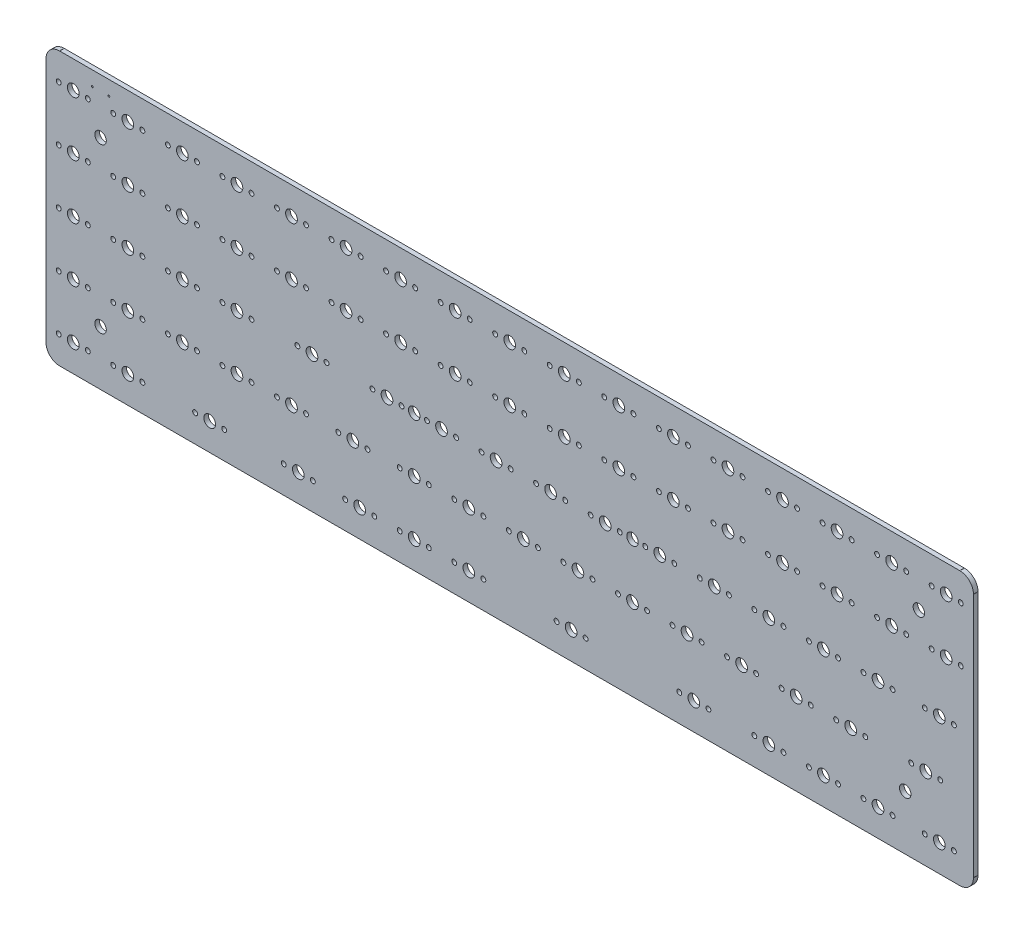
from build123d import *

# Parameters (mm, degrees)
SKETCH2_R           = 0.8534
SKETCH2_R_2         = 2.0447
SKETCH2_R_3         = 2
SKETCH2_R_4         = 0.325
BOSS_EXTRUDE3_DEPTH = 0.79375


with BuildPart() as part:
    # Sketch2 → Boss-Extrude3 (new, symmetric)
    with BuildSketch(Plane.XY):
        with BuildLine():
            ThreePointArc((314.2869, -4.7625), (314.298059232, -4.735559232), (314.325, -4.7244))
            Line((314.325, -4.7244), (314.325, 80.9244))
            ThreePointArc((314.325, 80.9244), (314.298059232, 80.935559232), (314.2869, 80.9625))
            ThreePointArc((314.2869, 80.9625), (314.298005094, 80.989386522), (314.324846721, 81.000599692))
            ThreePointArc((314.324846721, 81.000599692), (312.93006375, 84.33006375), (309.600599692, 85.724846721))
            ThreePointArc((309.600599692, 85.724846721), (309.589386522, 85.698005094), (309.5625, 85.6869))
            ThreePointArc((309.5625, 85.6869), (309.535559232, 85.698059232), (309.5244, 85.725))
            Line((309.5244, 85.725), (-4.7244, 85.725))
            ThreePointArc((-4.7244, 85.725), (-4.735559232, 85.698059232), (-4.7625, 85.6869))
            ThreePointArc((-4.7625, 85.6869), (-4.789386522, 85.698005094), (-4.800599692, 85.724846721))
            ThreePointArc((-4.800599692, 85.724846721), (-8.13006375, 84.33006375), (-9.524846721, 81.000599692))
            ThreePointArc((-9.524846721, 81.000599692), (-9.498005094, 80.989386522), (-9.4869, 80.9625))
            ThreePointArc((-9.4869, 80.9625), (-9.498059232, 80.935559232), (-9.525, 80.9244))
            Line((-9.525, 80.9244), (-9.525, -4.7244))
            ThreePointArc((-9.525, -4.7244), (-9.498059232, -4.735559232), (-9.4869, -4.7625))
            ThreePointArc((-9.4869, -4.7625), (-9.498005094, -4.789386522), (-9.524846721, -4.800599692))
            ThreePointArc((-9.524846721, -4.800599692), (-8.13006375, -8.13006375), (-4.800599692, -9.524846721))
            ThreePointArc((-4.800599692, -9.524846721), (-4.789386522, -9.498005094), (-4.7625, -9.4869))
            ThreePointArc((-4.7625, -9.4869), (-4.735559232, -9.498059232), (-4.7244, -9.525))
            Line((-4.7244, -9.525), (309.5244, -9.525))
            ThreePointArc((309.5244, -9.525), (309.535559232, -9.498059232), (309.5625, -9.4869))
            ThreePointArc((309.5625, -9.4869), (309.589386522, -9.498005094), (309.600599692, -9.524846721))
            ThreePointArc((309.600599692, -9.524846721), (312.93006375, -8.13006375), (314.324846721, -4.800599692))
            ThreePointArc((314.324846721, -4.800599692), (314.298005094, -4.789386522), (314.2869, -4.7625))
        make_face()
        with Locations((-5.08, 0)):
            Circle(SKETCH2_R, mode=Mode.SUBTRACT)
        Circle(SKETCH2_R_2, mode=Mode.SUBTRACT)
        with Locations((5.08, 0)):
            Circle(SKETCH2_R, mode=Mode.SUBTRACT)
        with Locations((13.97, 0)):
            Circle(SKETCH2_R, mode=Mode.SUBTRACT)
        with Locations((19.05, 0)):
            Circle(SKETCH2_R_2, mode=Mode.SUBTRACT)
        with Locations((24.13, 0)):
            Circle(SKETCH2_R, mode=Mode.SUBTRACT)
        with Locations((42.545, 0)):
            Circle(SKETCH2_R, mode=Mode.SUBTRACT)
        with Locations((47.625, 0)):
            Circle(SKETCH2_R_2, mode=Mode.SUBTRACT)
        with Locations((52.705, 0)):
            Circle(SKETCH2_R, mode=Mode.SUBTRACT)
        with Locations((9.525, 9.525)):
            Circle(SKETCH2_R_3, mode=Mode.SUBTRACT)
        with Locations((73.5012, 0)):
            Circle(SKETCH2_R, mode=Mode.SUBTRACT)
        with Locations((78.5812, 0)):
            Circle(SKETCH2_R_2, mode=Mode.SUBTRACT)
        with Locations((83.6613, 0)):
            Circle(SKETCH2_R, mode=Mode.SUBTRACT)
        with Locations((94.9325, 0)):
            Circle(SKETCH2_R, mode=Mode.SUBTRACT)
        with Locations((100.0125, 0)):
            Circle(SKETCH2_R_2, mode=Mode.SUBTRACT)
        with Locations((105.0925, 0)):
            Circle(SKETCH2_R, mode=Mode.SUBTRACT)
        with Locations((113.9825, 0)):
            Circle(SKETCH2_R, mode=Mode.SUBTRACT)
        with Locations((119.0625, 0)):
            Circle(SKETCH2_R_2, mode=Mode.SUBTRACT)
        with Locations((124.1425, 0)):
            Circle(SKETCH2_R, mode=Mode.SUBTRACT)
        with Locations((133.0325, 0)):
            Circle(SKETCH2_R, mode=Mode.SUBTRACT)
        with Locations((138.1125, 0)):
            Circle(SKETCH2_R_2, mode=Mode.SUBTRACT)
        with Locations((143.1925, 0)):
            Circle(SKETCH2_R, mode=Mode.SUBTRACT)
        with Locations((-5.08, 19.05)):
            Circle(SKETCH2_R, mode=Mode.SUBTRACT)
        with Locations((0, 19.05)):
            Circle(SKETCH2_R_2, mode=Mode.SUBTRACT)
        with Locations((5.08, 19.05)):
            Circle(SKETCH2_R, mode=Mode.SUBTRACT)
        with Locations((13.97, 19.05)):
            Circle(SKETCH2_R, mode=Mode.SUBTRACT)
        with Locations((19.05, 19.05)):
            Circle(SKETCH2_R_2, mode=Mode.SUBTRACT)
        with Locations((24.13, 19.05)):
            Circle(SKETCH2_R, mode=Mode.SUBTRACT)
        with Locations((33.02, 19.05)):
            Circle(SKETCH2_R, mode=Mode.SUBTRACT)
        with Locations((38.1, 19.05)):
            Circle(SKETCH2_R_2, mode=Mode.SUBTRACT)
        with Locations((43.18, 19.05)):
            Circle(SKETCH2_R, mode=Mode.SUBTRACT)
        with Locations((52.07, 19.05)):
            Circle(SKETCH2_R, mode=Mode.SUBTRACT)
        with Locations((57.15, 19.05)):
            Circle(SKETCH2_R_2, mode=Mode.SUBTRACT)
        with Locations((62.23, 19.05)):
            Circle(SKETCH2_R, mode=Mode.SUBTRACT)
        with Locations((71.12, 19.05)):
            Circle(SKETCH2_R, mode=Mode.SUBTRACT)
        with Locations((76.2, 19.05)):
            Circle(SKETCH2_R_2, mode=Mode.SUBTRACT)
        with Locations((81.28, 19.05)):
            Circle(SKETCH2_R, mode=Mode.SUBTRACT)
        with Locations((92.5513, 19.05)):
            Circle(SKETCH2_R, mode=Mode.SUBTRACT)
        with Locations((97.6313, 19.05)):
            Circle(SKETCH2_R_2, mode=Mode.SUBTRACT)
        with Locations((102.7113, 19.05)):
            Circle(SKETCH2_R, mode=Mode.SUBTRACT)
        with Locations((113.9825, 19.05)):
            Circle(SKETCH2_R, mode=Mode.SUBTRACT)
        with Locations((119.0625, 19.05)):
            Circle(SKETCH2_R_2, mode=Mode.SUBTRACT)
        with Locations((124.1425, 19.05)):
            Circle(SKETCH2_R, mode=Mode.SUBTRACT)
        with Locations((133.0325, 19.05)):
            Circle(SKETCH2_R, mode=Mode.SUBTRACT)
        with Locations((138.1125, 19.05)):
            Circle(SKETCH2_R_2, mode=Mode.SUBTRACT)
        with Locations((143.1925, 19.05)):
            Circle(SKETCH2_R, mode=Mode.SUBTRACT)
        with Locations((152.0825, 19.05)):
            Circle(SKETCH2_R, mode=Mode.SUBTRACT)
        with Locations((168.7512, 0)):
            Circle(SKETCH2_R, mode=Mode.SUBTRACT)
        with Locations((173.8313, 0)):
            Circle(SKETCH2_R_2, mode=Mode.SUBTRACT)
        with Locations((178.9112, 0)):
            Circle(SKETCH2_R, mode=Mode.SUBTRACT)
        with Locations((211.6138, 0)):
            Circle(SKETCH2_R, mode=Mode.SUBTRACT)
        with Locations((216.6938, 0)):
            Circle(SKETCH2_R_2, mode=Mode.SUBTRACT)
        with Locations((221.7738, 0)):
            Circle(SKETCH2_R, mode=Mode.SUBTRACT)
        with Locations((237.8075, 0)):
            Circle(SKETCH2_R, mode=Mode.SUBTRACT)
        with Locations((242.8875, 0)):
            Circle(SKETCH2_R_2, mode=Mode.SUBTRACT)
        with Locations((247.9675, 0)):
            Circle(SKETCH2_R, mode=Mode.SUBTRACT)
        with Locations((256.8575, 0)):
            Circle(SKETCH2_R, mode=Mode.SUBTRACT)
        with Locations((261.9375, 0)):
            Circle(SKETCH2_R_2, mode=Mode.SUBTRACT)
        with Locations((267.0175, 0)):
            Circle(SKETCH2_R, mode=Mode.SUBTRACT)
        with Locations((275.9075, 0)):
            Circle(SKETCH2_R, mode=Mode.SUBTRACT)
        with Locations((280.9875, 0)):
            Circle(SKETCH2_R_2, mode=Mode.SUBTRACT)
        with Locations((286.0675, 0)):
            Circle(SKETCH2_R, mode=Mode.SUBTRACT)
        with Locations((297.3388, 0)):
            Circle(SKETCH2_R, mode=Mode.SUBTRACT)
        with Locations((302.4187, 0)):
            Circle(SKETCH2_R_2, mode=Mode.SUBTRACT)
        with Locations((307.4988, 0)):
            Circle(SKETCH2_R, mode=Mode.SUBTRACT)
        with Locations((290.5125, 9.525)):
            Circle(SKETCH2_R_3, mode=Mode.SUBTRACT)
        with Locations((157.1625, 19.05)):
            Circle(SKETCH2_R_2, mode=Mode.SUBTRACT)
        with Locations((162.2425, 19.05)):
            Circle(SKETCH2_R, mode=Mode.SUBTRACT)
        with Locations((171.1325, 19.05)):
            Circle(SKETCH2_R, mode=Mode.SUBTRACT)
        with Locations((176.2125, 19.05)):
            Circle(SKETCH2_R_2, mode=Mode.SUBTRACT)
        with Locations((181.2925, 19.05)):
            Circle(SKETCH2_R, mode=Mode.SUBTRACT)
        with Locations((190.1825, 19.05)):
            Circle(SKETCH2_R, mode=Mode.SUBTRACT)
        with Locations((195.2625, 19.05)):
            Circle(SKETCH2_R_2, mode=Mode.SUBTRACT)
        with Locations((200.3425, 19.05)):
            Circle(SKETCH2_R, mode=Mode.SUBTRACT)
        with Locations((209.2325, 19.05)):
            Circle(SKETCH2_R, mode=Mode.SUBTRACT)
        with Locations((214.3125, 19.05)):
            Circle(SKETCH2_R_2, mode=Mode.SUBTRACT)
        with Locations((219.3925, 19.05)):
            Circle(SKETCH2_R, mode=Mode.SUBTRACT)
        with Locations((228.2825, 19.05)):
            Circle(SKETCH2_R, mode=Mode.SUBTRACT)
        with Locations((233.3625, 19.05)):
            Circle(SKETCH2_R_2, mode=Mode.SUBTRACT)
        with Locations((238.4425, 19.05)):
            Circle(SKETCH2_R, mode=Mode.SUBTRACT)
        with Locations((247.3325, 19.05)):
            Circle(SKETCH2_R, mode=Mode.SUBTRACT)
        with Locations((252.4125, 19.05)):
            Circle(SKETCH2_R_2, mode=Mode.SUBTRACT)
        with Locations((257.4925, 19.05)):
            Circle(SKETCH2_R, mode=Mode.SUBTRACT)
        with Locations((266.3825, 19.05)):
            Circle(SKETCH2_R, mode=Mode.SUBTRACT)
        with Locations((271.4625, 19.05)):
            Circle(SKETCH2_R_2, mode=Mode.SUBTRACT)
        with Locations((276.5425, 19.05)):
            Circle(SKETCH2_R, mode=Mode.SUBTRACT)
        with Locations((292.5763, 19.05)):
            Circle(SKETCH2_R, mode=Mode.SUBTRACT)
        with Locations((297.6563, 19.05)):
            Circle(SKETCH2_R_2, mode=Mode.SUBTRACT)
        with Locations((302.7363, 19.05)):
            Circle(SKETCH2_R, mode=Mode.SUBTRACT)
        with Locations((-5.08, 38.1)):
            Circle(SKETCH2_R, mode=Mode.SUBTRACT)
        with Locations((0, 38.1)):
            Circle(SKETCH2_R_2, mode=Mode.SUBTRACT)
        with Locations((5.08, 38.1)):
            Circle(SKETCH2_R, mode=Mode.SUBTRACT)
        with Locations((13.97, 38.1)):
            Circle(SKETCH2_R, mode=Mode.SUBTRACT)
        with Locations((19.05, 38.1)):
            Circle(SKETCH2_R_2, mode=Mode.SUBTRACT)
        with Locations((24.13, 38.1)):
            Circle(SKETCH2_R, mode=Mode.SUBTRACT)
        with Locations((33.02, 38.1)):
            Circle(SKETCH2_R, mode=Mode.SUBTRACT)
        with Locations((38.1, 38.1)):
            Circle(SKETCH2_R_2, mode=Mode.SUBTRACT)
        with Locations((43.18, 38.1)):
            Circle(SKETCH2_R, mode=Mode.SUBTRACT)
        with Locations((52.07, 38.1)):
            Circle(SKETCH2_R, mode=Mode.SUBTRACT)
        with Locations((57.15, 38.1)):
            Circle(SKETCH2_R_2, mode=Mode.SUBTRACT)
        with Locations((62.23, 38.1)):
            Circle(SKETCH2_R, mode=Mode.SUBTRACT)
        with Locations((-5.08, 57.15)):
            Circle(SKETCH2_R, mode=Mode.SUBTRACT)
        with Locations((0, 57.15)):
            Circle(SKETCH2_R_2, mode=Mode.SUBTRACT)
        with Locations((5.08, 57.15)):
            Circle(SKETCH2_R, mode=Mode.SUBTRACT)
        with Locations((13.97, 57.15)):
            Circle(SKETCH2_R, mode=Mode.SUBTRACT)
        with Locations((19.05, 57.15)):
            Circle(SKETCH2_R_2, mode=Mode.SUBTRACT)
        with Locations((24.13, 57.15)):
            Circle(SKETCH2_R, mode=Mode.SUBTRACT)
        with Locations((33.02, 57.15)):
            Circle(SKETCH2_R, mode=Mode.SUBTRACT)
        with Locations((38.1, 57.15)):
            Circle(SKETCH2_R_2, mode=Mode.SUBTRACT)
        with Locations((43.18, 57.15)):
            Circle(SKETCH2_R, mode=Mode.SUBTRACT)
        with Locations((52.07, 57.15)):
            Circle(SKETCH2_R, mode=Mode.SUBTRACT)
        with Locations((57.15, 57.15)):
            Circle(SKETCH2_R_2, mode=Mode.SUBTRACT)
        with Locations((62.23, 57.15)):
            Circle(SKETCH2_R, mode=Mode.SUBTRACT)
        with Locations((71.12, 57.15)):
            Circle(SKETCH2_R, mode=Mode.SUBTRACT)
        with Locations((78.2638, 38.1)):
            Circle(SKETCH2_R, mode=Mode.SUBTRACT)
        with Locations((83.3438, 38.1)):
            Circle(SKETCH2_R_2, mode=Mode.SUBTRACT)
        with Locations((88.4237, 38.1)):
            Circle(SKETCH2_R, mode=Mode.SUBTRACT)
        with Locations((104.4575, 38.1)):
            Circle(SKETCH2_R, mode=Mode.SUBTRACT)
        with Locations((109.5375, 38.1)):
            Circle(SKETCH2_R_2, mode=Mode.SUBTRACT)
        with Locations((114.6175, 38.1)):
            Circle(SKETCH2_R, mode=Mode.SUBTRACT)
        with Locations((119.0625, 38.1)):
            Circle(SKETCH2_R_3, mode=Mode.SUBTRACT)
        with Locations((123.5075, 38.1)):
            Circle(SKETCH2_R, mode=Mode.SUBTRACT)
        with Locations((128.5875, 38.1)):
            Circle(SKETCH2_R_2, mode=Mode.SUBTRACT)
        with Locations((133.6675, 38.1)):
            Circle(SKETCH2_R, mode=Mode.SUBTRACT)
        with Locations((142.5575, 38.1)):
            Circle(SKETCH2_R, mode=Mode.SUBTRACT)
        with Locations((147.6375, 38.1)):
            Circle(SKETCH2_R_2, mode=Mode.SUBTRACT)
        with Locations((76.2, 57.15)):
            Circle(SKETCH2_R_2, mode=Mode.SUBTRACT)
        with Locations((81.28, 57.15)):
            Circle(SKETCH2_R, mode=Mode.SUBTRACT)
        with Locations((90.17, 57.15)):
            Circle(SKETCH2_R, mode=Mode.SUBTRACT)
        with Locations((95.25, 57.15)):
            Circle(SKETCH2_R_2, mode=Mode.SUBTRACT)
        with Locations((100.33, 57.15)):
            Circle(SKETCH2_R, mode=Mode.SUBTRACT)
        with Locations((109.22, 57.15)):
            Circle(SKETCH2_R, mode=Mode.SUBTRACT)
        with Locations((114.3, 57.15)):
            Circle(SKETCH2_R_2, mode=Mode.SUBTRACT)
        with Locations((119.38, 57.15)):
            Circle(SKETCH2_R, mode=Mode.SUBTRACT)
        with Locations((128.27, 57.15)):
            Circle(SKETCH2_R, mode=Mode.SUBTRACT)
        with Locations((133.35, 57.15)):
            Circle(SKETCH2_R_2, mode=Mode.SUBTRACT)
        with Locations((138.43, 57.15)):
            Circle(SKETCH2_R, mode=Mode.SUBTRACT)
        with Locations((147.32, 57.15)):
            Circle(SKETCH2_R, mode=Mode.SUBTRACT)
        with Locations((9.525, 66.675)):
            Circle(SKETCH2_R_3, mode=Mode.SUBTRACT)
        with Locations((-5.08, 76.2)):
            Circle(SKETCH2_R, mode=Mode.SUBTRACT)
        with Locations((0, 76.2)):
            Circle(SKETCH2_R_2, mode=Mode.SUBTRACT)
        with Locations((5.08, 76.2)):
            Circle(SKETCH2_R, mode=Mode.SUBTRACT)
        with Locations((13.97, 76.2)):
            Circle(SKETCH2_R, mode=Mode.SUBTRACT)
        with Locations((19.05, 76.2)):
            Circle(SKETCH2_R_2, mode=Mode.SUBTRACT)
        with Locations((24.13, 76.2)):
            Circle(SKETCH2_R, mode=Mode.SUBTRACT)
        with Locations((6.635, 80.6463)):
            Circle(SKETCH2_R_4, mode=Mode.SUBTRACT)
        with Locations((12.415, 80.6463)):
            Circle(SKETCH2_R_4, mode=Mode.SUBTRACT)
        with Locations((33.02, 76.2)):
            Circle(SKETCH2_R, mode=Mode.SUBTRACT)
        with Locations((38.1, 76.2)):
            Circle(SKETCH2_R_2, mode=Mode.SUBTRACT)
        with Locations((43.18, 76.2)):
            Circle(SKETCH2_R, mode=Mode.SUBTRACT)
        with Locations((52.07, 76.2)):
            Circle(SKETCH2_R, mode=Mode.SUBTRACT)
        with Locations((57.15, 76.2)):
            Circle(SKETCH2_R_2, mode=Mode.SUBTRACT)
        with Locations((62.23, 76.2)):
            Circle(SKETCH2_R, mode=Mode.SUBTRACT)
        with Locations((71.12, 76.2)):
            Circle(SKETCH2_R, mode=Mode.SUBTRACT)
        with Locations((76.2, 76.2)):
            Circle(SKETCH2_R_2, mode=Mode.SUBTRACT)
        with Locations((81.28, 76.2)):
            Circle(SKETCH2_R, mode=Mode.SUBTRACT)
        with Locations((90.17, 76.2)):
            Circle(SKETCH2_R, mode=Mode.SUBTRACT)
        with Locations((95.25, 76.2)):
            Circle(SKETCH2_R_2, mode=Mode.SUBTRACT)
        with Locations((100.33, 76.2)):
            Circle(SKETCH2_R, mode=Mode.SUBTRACT)
        with Locations((109.22, 76.2)):
            Circle(SKETCH2_R, mode=Mode.SUBTRACT)
        with Locations((114.3, 76.2)):
            Circle(SKETCH2_R_2, mode=Mode.SUBTRACT)
        with Locations((119.38, 76.2)):
            Circle(SKETCH2_R, mode=Mode.SUBTRACT)
        with Locations((128.27, 76.2)):
            Circle(SKETCH2_R, mode=Mode.SUBTRACT)
        with Locations((133.35, 76.2)):
            Circle(SKETCH2_R_2, mode=Mode.SUBTRACT)
        with Locations((138.43, 76.2)):
            Circle(SKETCH2_R, mode=Mode.SUBTRACT)
        with Locations((147.32, 76.2)):
            Circle(SKETCH2_R, mode=Mode.SUBTRACT)
        with Locations((152.7175, 38.1)):
            Circle(SKETCH2_R, mode=Mode.SUBTRACT)
        with Locations((161.6075, 38.1)):
            Circle(SKETCH2_R, mode=Mode.SUBTRACT)
        with Locations((166.6875, 38.1)):
            Circle(SKETCH2_R_2, mode=Mode.SUBTRACT)
        with Locations((171.7675, 38.1)):
            Circle(SKETCH2_R, mode=Mode.SUBTRACT)
        with Locations((180.6575, 38.1)):
            Circle(SKETCH2_R, mode=Mode.SUBTRACT)
        with Locations((185.7375, 38.1)):
            Circle(SKETCH2_R_2, mode=Mode.SUBTRACT)
        with Locations((190.8175, 38.1)):
            Circle(SKETCH2_R, mode=Mode.SUBTRACT)
        with Locations((195.2625, 38.1)):
            Circle(SKETCH2_R_3, mode=Mode.SUBTRACT)
        with Locations((199.7075, 38.1)):
            Circle(SKETCH2_R, mode=Mode.SUBTRACT)
        with Locations((204.7875, 38.1)):
            Circle(SKETCH2_R_2, mode=Mode.SUBTRACT)
        with Locations((209.8675, 38.1)):
            Circle(SKETCH2_R, mode=Mode.SUBTRACT)
        with Locations((218.7575, 38.1)):
            Circle(SKETCH2_R, mode=Mode.SUBTRACT)
        with Locations((223.8375, 38.1)):
            Circle(SKETCH2_R_2, mode=Mode.SUBTRACT)
        with Locations((228.9175, 38.1)):
            Circle(SKETCH2_R, mode=Mode.SUBTRACT)
        with Locations((152.4, 57.15)):
            Circle(SKETCH2_R_2, mode=Mode.SUBTRACT)
        with Locations((157.48, 57.15)):
            Circle(SKETCH2_R, mode=Mode.SUBTRACT)
        with Locations((166.37, 57.15)):
            Circle(SKETCH2_R, mode=Mode.SUBTRACT)
        with Locations((171.45, 57.15)):
            Circle(SKETCH2_R_2, mode=Mode.SUBTRACT)
        with Locations((176.53, 57.15)):
            Circle(SKETCH2_R, mode=Mode.SUBTRACT)
        with Locations((185.42, 57.15)):
            Circle(SKETCH2_R, mode=Mode.SUBTRACT)
        with Locations((190.5, 57.15)):
            Circle(SKETCH2_R_2, mode=Mode.SUBTRACT)
        with Locations((195.58, 57.15)):
            Circle(SKETCH2_R, mode=Mode.SUBTRACT)
        with Locations((204.47, 57.15)):
            Circle(SKETCH2_R, mode=Mode.SUBTRACT)
        with Locations((209.55, 57.15)):
            Circle(SKETCH2_R_2, mode=Mode.SUBTRACT)
        with Locations((214.63, 57.15)):
            Circle(SKETCH2_R, mode=Mode.SUBTRACT)
        with Locations((223.52, 57.15)):
            Circle(SKETCH2_R, mode=Mode.SUBTRACT)
        with Locations((228.6, 57.15)):
            Circle(SKETCH2_R_2, mode=Mode.SUBTRACT)
        with Locations((237.8075, 38.1)):
            Circle(SKETCH2_R, mode=Mode.SUBTRACT)
        with Locations((242.8875, 38.1)):
            Circle(SKETCH2_R_2, mode=Mode.SUBTRACT)
        with Locations((247.9675, 38.1)):
            Circle(SKETCH2_R, mode=Mode.SUBTRACT)
        with Locations((256.8575, 38.1)):
            Circle(SKETCH2_R, mode=Mode.SUBTRACT)
        with Locations((261.9375, 38.1)):
            Circle(SKETCH2_R_2, mode=Mode.SUBTRACT)
        with Locations((267.0175, 38.1)):
            Circle(SKETCH2_R, mode=Mode.SUBTRACT)
        with Locations((275.9075, 38.1)):
            Circle(SKETCH2_R, mode=Mode.SUBTRACT)
        with Locations((280.9875, 38.1)):
            Circle(SKETCH2_R_2, mode=Mode.SUBTRACT)
        with Locations((286.0675, 38.1)):
            Circle(SKETCH2_R, mode=Mode.SUBTRACT)
        with Locations((297.3388, 38.1)):
            Circle(SKETCH2_R, mode=Mode.SUBTRACT)
        with Locations((302.4187, 38.1)):
            Circle(SKETCH2_R_2, mode=Mode.SUBTRACT)
        with Locations((307.4988, 38.1)):
            Circle(SKETCH2_R, mode=Mode.SUBTRACT)
        with Locations((233.68, 57.15)):
            Circle(SKETCH2_R, mode=Mode.SUBTRACT)
        with Locations((242.57, 57.15)):
            Circle(SKETCH2_R, mode=Mode.SUBTRACT)
        with Locations((247.65, 57.15)):
            Circle(SKETCH2_R_2, mode=Mode.SUBTRACT)
        with Locations((252.73, 57.15)):
            Circle(SKETCH2_R, mode=Mode.SUBTRACT)
        with Locations((261.62, 57.15)):
            Circle(SKETCH2_R, mode=Mode.SUBTRACT)
        with Locations((266.7, 57.15)):
            Circle(SKETCH2_R_2, mode=Mode.SUBTRACT)
        with Locations((271.78, 57.15)):
            Circle(SKETCH2_R, mode=Mode.SUBTRACT)
        with Locations((280.67, 57.15)):
            Circle(SKETCH2_R, mode=Mode.SUBTRACT)
        with Locations((285.75, 57.15)):
            Circle(SKETCH2_R_2, mode=Mode.SUBTRACT)
        with Locations((290.83, 57.15)):
            Circle(SKETCH2_R, mode=Mode.SUBTRACT)
        with Locations((299.72, 57.15)):
            Circle(SKETCH2_R, mode=Mode.SUBTRACT)
        with Locations((304.8, 57.15)):
            Circle(SKETCH2_R_2, mode=Mode.SUBTRACT)
        with Locations((309.88, 57.15)):
            Circle(SKETCH2_R, mode=Mode.SUBTRACT)
        with Locations((152.4, 76.2)):
            Circle(SKETCH2_R_2, mode=Mode.SUBTRACT)
        with Locations((157.48, 76.2)):
            Circle(SKETCH2_R, mode=Mode.SUBTRACT)
        with Locations((166.37, 76.2)):
            Circle(SKETCH2_R, mode=Mode.SUBTRACT)
        with Locations((171.45, 76.2)):
            Circle(SKETCH2_R_2, mode=Mode.SUBTRACT)
        with Locations((176.53, 76.2)):
            Circle(SKETCH2_R, mode=Mode.SUBTRACT)
        with Locations((185.42, 76.2)):
            Circle(SKETCH2_R, mode=Mode.SUBTRACT)
        with Locations((190.5, 76.2)):
            Circle(SKETCH2_R_2, mode=Mode.SUBTRACT)
        with Locations((195.58, 76.2)):
            Circle(SKETCH2_R, mode=Mode.SUBTRACT)
        with Locations((204.47, 76.2)):
            Circle(SKETCH2_R, mode=Mode.SUBTRACT)
        with Locations((209.55, 76.2)):
            Circle(SKETCH2_R_2, mode=Mode.SUBTRACT)
        with Locations((214.63, 76.2)):
            Circle(SKETCH2_R, mode=Mode.SUBTRACT)
        with Locations((223.52, 76.2)):
            Circle(SKETCH2_R, mode=Mode.SUBTRACT)
        with Locations((228.6, 76.2)):
            Circle(SKETCH2_R_2, mode=Mode.SUBTRACT)
        with Locations((295.275, 66.675)):
            Circle(SKETCH2_R_3, mode=Mode.SUBTRACT)
        with Locations((233.68, 76.2)):
            Circle(SKETCH2_R, mode=Mode.SUBTRACT)
        with Locations((242.57, 76.2)):
            Circle(SKETCH2_R, mode=Mode.SUBTRACT)
        with Locations((247.65, 76.2)):
            Circle(SKETCH2_R_2, mode=Mode.SUBTRACT)
        with Locations((252.73, 76.2)):
            Circle(SKETCH2_R, mode=Mode.SUBTRACT)
        with Locations((261.62, 76.2)):
            Circle(SKETCH2_R, mode=Mode.SUBTRACT)
        with Locations((266.7, 76.2)):
            Circle(SKETCH2_R_2, mode=Mode.SUBTRACT)
        with Locations((271.78, 76.2)):
            Circle(SKETCH2_R, mode=Mode.SUBTRACT)
        with Locations((280.67, 76.2)):
            Circle(SKETCH2_R, mode=Mode.SUBTRACT)
        with Locations((285.75, 76.2)):
            Circle(SKETCH2_R_2, mode=Mode.SUBTRACT)
        with Locations((290.83, 76.2)):
            Circle(SKETCH2_R, mode=Mode.SUBTRACT)
        with Locations((299.72, 76.2)):
            Circle(SKETCH2_R, mode=Mode.SUBTRACT)
        with Locations((304.8, 76.2)):
            Circle(SKETCH2_R_2, mode=Mode.SUBTRACT)
        with Locations((309.88, 76.2)):
            Circle(SKETCH2_R, mode=Mode.SUBTRACT)
    extrude(amount=BOSS_EXTRUDE3_DEPTH, both=True)


solid = part.part
